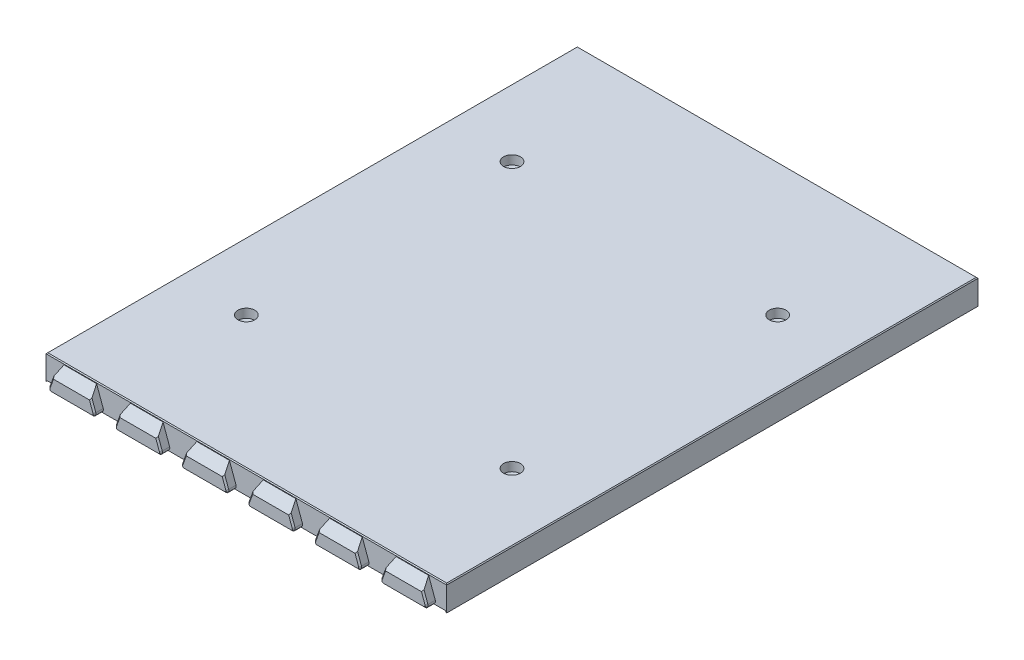
from build123d import *

# Parameters (mm, degrees)
BOSS_EXTRUDE1_DEPTH             = 90
SKETCH7_W                       = 131.75
SKETCH7_H                       = 6
BOSS_EXTRUDE7_DEPTH             = 1
BOSS_EXTRUDE4_DEPTH             = 3
BOSS_EXTRUDE8_REACH             = 115.009
BOSS_EXTRUDE8_DIRECTION_2_DEPTH = 2
CHAMFER4_SIZE                   = 0.5
FILLET4_R                       = 1
CHAMFER6_SIZE                   = 0.5
FILLET2_R                       = 2
CHAMFER4_OF_MIRROR2_SIZE        = 0.5
FILLET4_OF_MIRROR2_R            = 1
CHAMFER6_OF_MIRROR2_SIZE        = 0.5
FILLET2_OF_MIRROR2_R            = 2
BOSS_EXTRUDE9_REACH             = 197.346
SKETCH9_R                       = 5
FILLET3_R                       = 3
SKETCH10_R                      = 1.85
CUT_EXTRUDE2_DEPTH              = 196.345887146
SKETCH11_R                      = 2.85
CUT_EXTRUDE3_DEPTH              = 3
CHAMFER7_SIZE                   = 1
CUT_EXTRUDE4_DEPTH              = 196.345887146
CUT_EXTRUDE4_DEPTH_BACK         = 196.345887146
BOSS_EXTRUDE10_DEPTH            = 180
CHAMFER8_SIZE                   = 0.3


with BuildPart() as part:
    # Sketch1 → Boss-Extrude1 (new body)
    with BuildSketch(Plane.XY):
        Polygon((-67.875, 0), (-67.875, 8), (67.875, 8), (67.875, 0), (65.875, 0), (65.875, 6), (-65.875, 6), (-65.875, 0), align=None)
    boss_extrude1 = extrude(amount=-BOSS_EXTRUDE1_DEPTH)

    # Sketch7 → Boss-Extrude7 (add)
    with BuildSketch(Plane.XY):
        with Locations((0, 3)):
            Rectangle(SKETCH7_W, SKETCH7_H)
    boss_extrude7 = extrude(amount=-BOSS_EXTRUDE7_DEPTH)

    # Sketch2 → Boss-Extrude4 (add)
    with BuildSketch(Plane.XY):
        Polygon((50.911761874, 8), (48, 0), (64.5, 0), (61.588238126, 8), align=None)
        Polygon((28.411761874, 8), (25.5, 0), (42, 0), (39.088238126, 8), align=None)
        Polygon((5.911761874, 8), (3, 0), (19.5, 0), (16.588238126, 8), align=None)
        Polygon((-16.588238126, 8), (-19.5, 0), (-3, 0), (-5.911761874, 8), align=None)
        Polygon((-39.088238126, 8), (-42, 0), (-25.5, 0), (-28.411761874, 8), align=None)
        Polygon((-61.588238126, 8), (-64.5, 0), (-48, 0), (-50.911761874, 8), align=None)
    boss_extrude4 = extrude(amount=BOSS_EXTRUDE4_DEPTH)

    # Sketch8 → Boss-Extrude8 (add, up to next)
    with BuildSketch(Plane.XZ, mode=Mode.PRIVATE) as boss_extrude8_sk1:
        Polygon((-66.35, -20.258341264), (-62.65, -21.605031131), (-62.65, -23.394968869), (-66.35, -24.741658736), align=None)
    boss_extrude8_tool1 = extrude(boss_extrude8_sk1.sketch, amount=-BOSS_EXTRUDE8_REACH, mode=Mode.PRIVATE) - part.part
    # Sketch8 → Boss-Extrude8 (add, up to next)
    with BuildSketch(Plane.XZ, mode=Mode.PRIVATE) as boss_extrude8_sk2:
        Polygon((-66.35, -89.85), (-66.35, -87.758341264), (-62.65, -89.105031131), (-62.65, -89.85), (-62.65, -90), (-66.35, -90), align=None)
    boss_extrude8_tool2 = extrude(boss_extrude8_sk2.sketch, amount=-BOSS_EXTRUDE8_REACH, mode=Mode.PRIVATE) - part.part
    # Sketch8 → Boss-Extrude8 (add, up to next)
    with BuildSketch(Plane.XZ, mode=Mode.PRIVATE) as boss_extrude8_sk3:
        Polygon((66.35, -90), (62.65, -90), (62.65, -89.85), (62.65, -89.105031131), (66.35, -87.758341264), (66.35, -89.85), align=None)
    boss_extrude8_tool3 = extrude(boss_extrude8_sk3.sketch, amount=-BOSS_EXTRUDE8_REACH, mode=Mode.PRIVATE) - part.part
    # Sketch8 → Boss-Extrude8 (add, up to next)
    with BuildSketch(Plane.XZ, mode=Mode.PRIVATE) as boss_extrude8_sk4:
        Polygon((66.35, -24.741658736), (66.35, -20.258341264), (62.65, -21.605031131), (62.65, -23.394968869), align=None)
    boss_extrude8_tool4 = extrude(boss_extrude8_sk4.sketch, amount=-BOSS_EXTRUDE8_REACH, mode=Mode.PRIVATE) - part.part
    boss_extrude8_1 = boss_extrude8_tool1.solids().sort_by_distance((-64.764762, 0, -22.5))[0]
    add(boss_extrude8_1)
    boss_extrude8_2 = boss_extrude8_tool2.solids().sort_by_distance((-64.764762, 0, -89.16766))[0]
    add(boss_extrude8_2)
    boss_extrude8_3 = boss_extrude8_tool3.solids().sort_by_distance((64.764762, 0, -89.16766))[0]
    add(boss_extrude8_3)
    boss_extrude8_4 = boss_extrude8_tool4.solids().sort_by_distance((64.764762, 0, -22.5))[0]
    add(boss_extrude8_4)
    boss_extrude8 = boss_extrude8_1 + boss_extrude8_2 + boss_extrude8_3 + boss_extrude8_4  # Boss-Extrude8 as one shape, for the pattern or mirror that repeats it

    # Sketch8 → Boss-Extrude8 direction 2 (add)
    with BuildSketch(Plane.XZ):
        Polygon((-66.35, -20.258341264), (-62.65, -21.605031131), (-62.65, -23.394968869), (-66.35, -24.741658736), align=None)
        Polygon((-66.35, -89.85), (-66.35, -87.758341264), (-62.65, -89.105031131), (-62.65, -89.85), (-62.65, -90), (-66.35, -90), align=None)
        Polygon((66.35, -90), (62.65, -90), (62.65, -89.85), (62.65, -89.105031131), (66.35, -87.758341264), (66.35, -89.85), align=None)
        Polygon((66.35, -24.741658736), (66.35, -20.258341264), (62.65, -21.605031131), (62.65, -23.394968869), align=None)
    boss_extrude8_direction_2 = extrude(amount=BOSS_EXTRUDE8_DIRECTION_2_DEPTH)

    # Chamfer4
    chamfer4_edges = [part.edges().sort_by_distance(p)[0] for p in [
        (-66.35, -2, -22.5),
        (-64.5, -2, -24.068313803),
        (-62.65, -2, -22.5),
        (-64.5, -2, -20.931686197),
        (-66.35, -2, -88.879170632),
        (-62.65, -2, -89.552515565),
        (-64.5, -2, -88.431686197),
        (66.35, -2, -88.879170632),
        (64.5, -2, -88.431686197),
        (62.65, -2, -89.552515565),
        (64.5, -2, -24.068313803),
        (66.35, -2, -22.5),
        (64.5, -2, -20.931686197),
        (62.65, -2, -22.5),
    ]]
    chamfer(chamfer4_edges, length=CHAMFER4_SIZE)

    # Fillet4
    fillet4_edges = [part.edges().sort_by_distance(p)[0] for p in [
        (-64.5, 0, 1.5),
        (-48, 0, 1.5),
        (48, 0, 1.5),
        (64.5, 0, 1.5),
        (25.5, 0, 1.5),
        (42, 0, 1.5),
        (3, 0, 1.5),
        (19.5, 0, 1.5),
        (-42, 0, 1.5),
        (-25.5, 0, 1.5),
        (-19.5, 0, 1.5),
        (-3, 0, 1.5),
    ]]
    fillet(fillet4_edges, radius=FILLET4_R)

    # Chamfer6
    chamfer6_edges = [part.edges().sort_by_distance(p)[0] for p in [
        (-62.79989137, 4.671010072, 3),
        (62.79989137, 4.671010072, 3),
        (56.25, 0, 3),
        (33.75, 0, 3),
        (11.25, 0, 3),
        (-11.25, 0, 3),
        (-33.75, 0, 3),
        (-56.25, 0, 3),
        (48.608995962, 0.426423564, 3),
        (63.891004038, 0.426423564, 3),
        (40.29989137, 4.671010072, 3),
        (26.108995962, 0.426423564, 3),
        (41.391004038, 0.426423564, 3),
        (17.79989137, 4.671010072, 3),
        (3.608995962, 0.426423564, 3),
        (18.891004038, 0.426423564, 3),
        (-4.70010863, 4.671010072, 3),
        (-18.891004038, 0.426423564, 3),
        (-3.608995962, 0.426423564, 3),
        (-27.20010863, 4.671010072, 3),
        (-41.391004038, 0.426423564, 3),
        (-26.108995962, 0.426423564, 3),
        (-49.70010863, 4.671010072, 3),
        (-63.891004038, 0.426423564, 3),
        (-48.608995962, 0.426423564, 3),
        (49.70010863, 4.671010072, 3),
        (27.20010863, 4.671010072, 3),
        (4.70010863, 4.671010072, 3),
        (-40.29989137, 4.671010072, 3),
        (-17.79989137, 4.671010072, 3),
    ]]
    chamfer(chamfer6_edges, length=CHAMFER6_SIZE)

    # Fillet2
    fillet2_edges = [part.edges().sort_by_distance(p)[0] for p in [
        (-65.875, 6, -10.715613563),
        (-65.875, 3, -24.568772875),
        (-65.875, 3, -20.431227125),
        (-64.2625, 6, -23.981870872),
        (-64.2625, 6, -21.018129128),
        (-62.65, 6, -22.5),
        (-65.875, 6, -56.25),
        (-65.875, 3, -87.931227125),
        (-62.65, 6, -89.552515565),
        (-64.2625, 6, -88.518129128),
        (65.875, 6, -56.25),
        (65.875, 3, -87.931227125),
        (64.2625, 6, -88.518129128),
        (62.65, 6, -89.552515565),
        (65.875, 6, -10.715613563),
        (65.875, 3, -24.568772875),
        (65.875, 3, -20.431227125),
        (64.2625, 6, -23.981870872),
        (62.65, 6, -22.5),
        (64.2625, 6, -21.018129128),
        (-65.875, 3, -1),
        (0, 6, -1),
        (65.875, 3, -1),
    ]]
    fillet(fillet2_edges, radius=FILLET2_R)


with BuildPart() as mirror2_1:
    # Mirror2: Boss-Extrude1, Boss-Extrude7, Boss-Extrude4, Boss-Extrude8, Boss-Extrude8 direction 2 across plane
    add(boss_extrude1.mirror(Plane.XY.offset(-90)))
    add(boss_extrude7.mirror(Plane.XY.offset(-90)))
    add(boss_extrude4.mirror(Plane.XY.offset(-90)))
    add(boss_extrude8.mirror(Plane.XY.offset(-90)))
    add(boss_extrude8_direction_2.mirror(Plane.XY.offset(-90)))

    # Chamfer4 of Mirror2
    chamfer4_of_mirror2_edges = [mirror2_1.edges().sort_by_distance(p)[0] for p in [
        (-66.35, -2, -157.5),
        (-64.5, -2, -155.931686197),
        (-62.65, -2, -157.5),
        (-64.5, -2, -159.068313803),
        (-66.35, -2, -91.120829368),
        (-62.65, -2, -90.447484435),
        (-64.5, -2, -91.568313803),
        (66.35, -2, -91.120829368),
        (64.5, -2, -91.568313803),
        (62.65, -2, -90.447484435),
        (64.5, -2, -155.931686197),
        (66.35, -2, -157.5),
        (64.5, -2, -159.068313803),
        (62.65, -2, -157.5),
    ]]
    chamfer(chamfer4_of_mirror2_edges, length=CHAMFER4_OF_MIRROR2_SIZE)

    # Fillet4 of Mirror2
    fillet4_of_mirror2_edges = [mirror2_1.edges().sort_by_distance(p)[0] for p in [
        (-64.5, 0, -181.5),
        (-48, 0, -181.5),
        (48, 0, -181.5),
        (64.5, 0, -181.5),
        (25.5, 0, -181.5),
        (42, 0, -181.5),
        (3, 0, -181.5),
        (19.5, 0, -181.5),
        (-42, 0, -181.5),
        (-25.5, 0, -181.5),
        (-19.5, 0, -181.5),
        (-3, 0, -181.5),
    ]]
    fillet(fillet4_of_mirror2_edges, radius=FILLET4_OF_MIRROR2_R)

    # Chamfer6 of Mirror2
    chamfer6_of_mirror2_edges = [mirror2_1.edges().sort_by_distance(p)[0] for p in [
        (-62.79989137, 4.671010072, -183),
        (62.79989137, 4.671010072, -183),
        (56.25, 0, -183),
        (33.75, 0, -183),
        (11.25, 0, -183),
        (-11.25, 0, -183),
        (-33.75, 0, -183),
        (-56.25, 0, -183),
        (48.608995962, 0.426423564, -183),
        (63.891004038, 0.426423564, -183),
        (40.29989137, 4.671010072, -183),
        (26.108995962, 0.426423564, -183),
        (41.391004038, 0.426423564, -183),
        (17.79989137, 4.671010072, -183),
        (3.608995962, 0.426423564, -183),
        (18.891004038, 0.426423564, -183),
        (-4.70010863, 4.671010072, -183),
        (-18.891004038, 0.426423564, -183),
        (-3.608995962, 0.426423564, -183),
        (-27.20010863, 4.671010072, -183),
        (-41.391004038, 0.426423564, -183),
        (-26.108995962, 0.426423564, -183),
        (-49.70010863, 4.671010072, -183),
        (-63.891004038, 0.426423564, -183),
        (-48.608995962, 0.426423564, -183),
        (49.70010863, 4.671010072, -183),
        (27.20010863, 4.671010072, -183),
        (4.70010863, 4.671010072, -183),
        (-40.29989137, 4.671010072, -183),
        (-17.79989137, 4.671010072, -183),
    ]]
    chamfer(chamfer6_of_mirror2_edges, length=CHAMFER6_OF_MIRROR2_SIZE)

    # Fillet2 of Mirror2
    fillet2_of_mirror2_edges = [mirror2_1.edges().sort_by_distance(p)[0] for p in [
        (-65.875, 6, -169.284386437),
        (-65.875, 3, -155.431227125),
        (-65.875, 3, -159.568772875),
        (-64.2625, 6, -156.018129128),
        (-64.2625, 6, -158.981870872),
        (-62.65, 6, -157.5),
        (-65.875, 6, -123.75),
        (-65.875, 3, -92.068772875),
        (-62.65, 6, -90.447484435),
        (-64.2625, 6, -91.481870872),
        (65.875, 6, -123.75),
        (65.875, 3, -92.068772875),
        (64.2625, 6, -91.481870872),
        (62.65, 6, -90.447484435),
        (65.875, 6, -169.284386437),
        (65.875, 3, -155.431227125),
        (65.875, 3, -159.568772875),
        (64.2625, 6, -156.018129128),
        (62.65, 6, -157.5),
        (64.2625, 6, -158.981870872),
        (-65.875, 3, -179),
        (0, 6, -179),
        (65.875, 3, -179),
    ]]
    fillet(fillet2_of_mirror2_edges, radius=FILLET2_OF_MIRROR2_R)


with BuildPart() as part_1:
    add(part.part)

    # Mirror2 united with what the copies touc: union Mirror2_1
    add(mirror2_1.part)

    # Sketch9 → Boss-Extrude9 (add, up to next)
    with BuildSketch(Plane(origin=(0, 0, 0), x_dir=(1, 0, 0), z_dir=(0, 1, 0)), mode=Mode.PRIVATE) as boss_extrude9_sk1:
        with Locations(Location((-45, 45, 0), (0, 0, 90))):
            Circle(SKETCH9_R)
    boss_extrude9_tool1 = extrude(boss_extrude9_sk1.sketch, amount=BOSS_EXTRUDE9_REACH, mode=Mode.PRIVATE) - part_1.part
    # Sketch9 → Boss-Extrude9 (add, up to next)
    with BuildSketch(Plane(origin=(0, 0, 0), x_dir=(1, 0, 0), z_dir=(0, 1, 0)), mode=Mode.PRIVATE) as boss_extrude9_sk2:
        with Locations(Location((45, 45, 0), (0, 0, 90))):
            Circle(SKETCH9_R)
    boss_extrude9_tool2 = extrude(boss_extrude9_sk2.sketch, amount=BOSS_EXTRUDE9_REACH, mode=Mode.PRIVATE) - part_1.part
    # Sketch9 → Boss-Extrude9 (add, up to next)
    with BuildSketch(Plane(origin=(0, 0, 0), x_dir=(1, 0, 0), z_dir=(0, 1, 0)), mode=Mode.PRIVATE) as boss_extrude9_sk3:
        with Locations(Location((45, 135, 0), (0, 0, 90))):
            Circle(SKETCH9_R)
    boss_extrude9_tool3 = extrude(boss_extrude9_sk3.sketch, amount=BOSS_EXTRUDE9_REACH, mode=Mode.PRIVATE) - part_1.part
    # Sketch9 → Boss-Extrude9 (add, up to next)
    with BuildSketch(Plane(origin=(0, 0, 0), x_dir=(1, 0, 0), z_dir=(0, 1, 0)), mode=Mode.PRIVATE) as boss_extrude9_sk4:
        with Locations(Location((-45, 135, 0), (0, 0, 90))):
            Circle(SKETCH9_R)
    boss_extrude9_tool4 = extrude(boss_extrude9_sk4.sketch, amount=BOSS_EXTRUDE9_REACH, mode=Mode.PRIVATE) - part_1.part
    add(boss_extrude9_tool1.solids().sort_by_distance((-45, 0, -45))[0])
    add(boss_extrude9_tool2.solids().sort_by_distance((45, 0, -45))[0])
    add(boss_extrude9_tool3.solids().sort_by_distance((45, 0, -135))[0])
    add(boss_extrude9_tool4.solids().sort_by_distance((-45, 0, -135))[0])

    # Fillet3
    fillet3_edges = [part_1.edges().sort_by_distance(p)[0] for p in [
        (-45, 6, -40),
        (-45, 6, -130),
        (45, 6, -130),
        (45, 6, -40),
    ]]
    fillet(fillet3_edges, radius=FILLET3_R)

    # Sketch10 → Cut-Extrude2 (cut, through all)
    with BuildSketch(Plane(origin=(0, 0, 0), x_dir=(1, 0, 0), z_dir=(0, 1, 0))):
        with Locations(Location((-45, 135, 0), (0, 0, 270))):
            Circle(SKETCH10_R)
        with Locations(Location((-45, 45, 0), (0, 0, 270))):
            Circle(SKETCH10_R)
        with Locations(Location((45, 45, 0), (0, 0, 270))):
            Circle(SKETCH10_R)
        with Locations(Location((45, 135, 0), (0, 0, 270))):
            Circle(SKETCH10_R)
    extrude(amount=CUT_EXTRUDE2_DEPTH, mode=Mode.SUBTRACT)

    # Sketch11 → Cut-Extrude3 (cut)
    with BuildSketch(Plane(origin=(0, 8, 0), x_dir=(1, 0, 0), z_dir=(0, 1, 0))):
        with Locations(Location((-45, 135, 0), (0, 0, 270))):
            Circle(SKETCH11_R)
        with Locations(Location((45, 135, 0), (0, 0, 270))):
            Circle(SKETCH11_R)
        with Locations(Location((45, 45, 0), (0, 0, 270))):
            Circle(SKETCH11_R)
        with Locations(Location((-45, 45, 0), (0, 0, 270))):
            Circle(SKETCH11_R)
    extrude(amount=-CUT_EXTRUDE3_DEPTH, mode=Mode.SUBTRACT)

    # Chamfer7
    chamfer7_edges = [part_1.edges().sort_by_distance(p)[0] for p in [
        (-45, 5, -46.85),
        (45, 5, -46.85),
        (45, 5, -136.85),
        (-45, 5, -136.85),
    ]]
    chamfer(chamfer7_edges, length=CHAMFER7_SIZE - 0.0001)  # a hair under: the kernel refuses the full size

    # Sketch12 → Cut-Extrude4 (cut, two sides: drawn at the far end of the back side and taken through both)
    with BuildSketch(Plane(origin=(0, 0, 0), x_dir=(0, 0, -1), z_dir=(1, 0, 0)).offset(-CUT_EXTRUDE4_DEPTH_BACK)):
        Polygon((0, 7.5), (-3, 4.5), (-3, 7.5), (-3, 8), (0, 8), align=None)
        Polygon((183, 4.5), (183, 7.5), (183, 8), (180, 8), (180, 7.5), align=None)
    extrude(amount=CUT_EXTRUDE4_DEPTH + CUT_EXTRUDE4_DEPTH_BACK, mode=Mode.SUBTRACT)

    # Sketch13 → Boss-Extrude10 (add)
    with BuildSketch(Plane(origin=(0, 0, -180), x_dir=(-1, 0, 0), z_dir=(0, 0, -1))):
        Polygon((-67.375, 0), (-67.875, -0.5), (-67.875, 0), align=None)
        Polygon((67.875, 0), (67.375, 0), (67.875, -0.5), align=None)
    extrude(amount=-BOSS_EXTRUDE10_DEPTH)

    # Chamfer8
    chamfer8_edges = [part_1.edges().sort_by_distance(p)[0] for p in [
        (-67.875, 8, -90),
        (67.875, 8, -90),
        (0, 8, -180),
        (0, 8, 0),
    ]]
    chamfer(chamfer8_edges, length=CHAMFER8_SIZE)


solid = part_1.part
